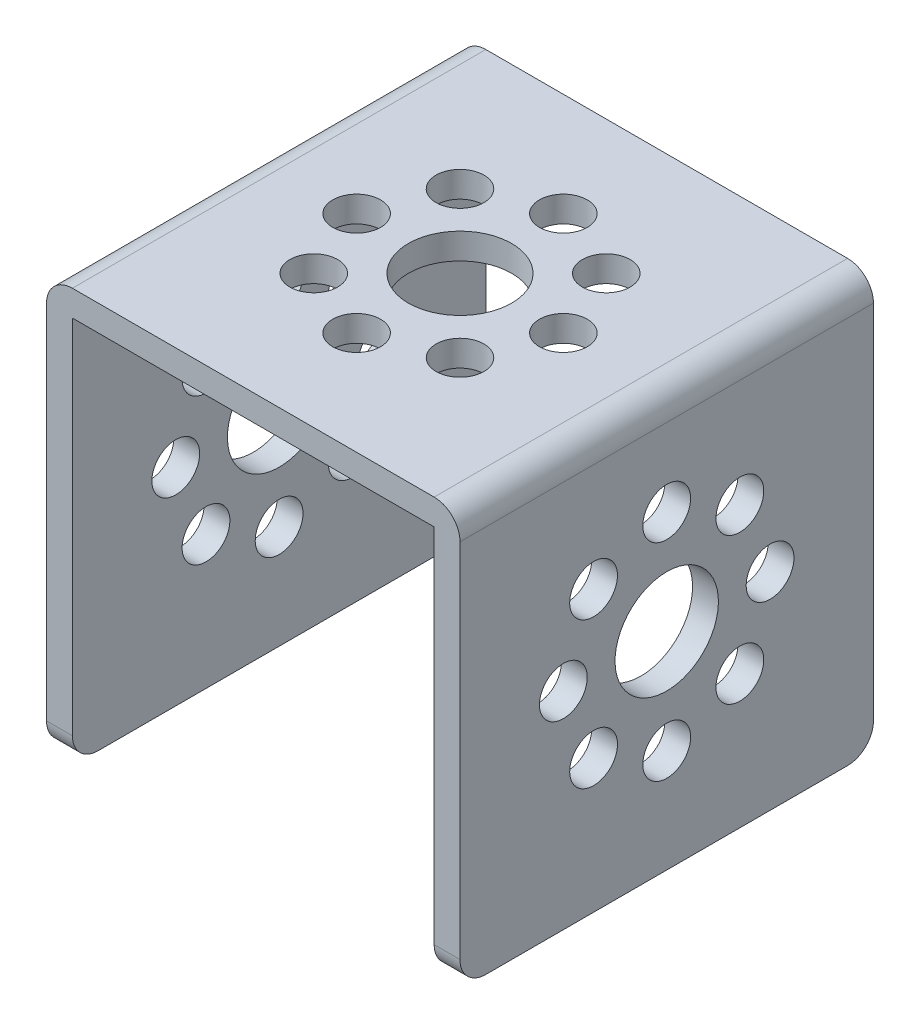
from build123d import *

# Parameters (mm, degrees)
BOSS_EXTRUDE1_DEPTH = 32
SKETCH2_R           = 1.85
SKETCH2_R_2         = 4
CUT_EXTRUDE1_DEPTH  = 49
SKETCH3_R           = 1.85
SKETCH3_R_2         = 4
CUT_EXTRUDE2_DEPTH  = 49
FILLET1_R           = 2


with BuildPart() as part:
    # Sketch1 → Boss-Extrude1 (new body)
    with BuildSketch(Plane.XY):
        Polygon((14, -16), (16, -16), (16, 16), (-16, 16), (-16, -16), (-14, -16), (-14, 14), (14, 14), align=None)
    extrude(amount=-BOSS_EXTRUDE1_DEPTH)

    # Sketch2 → Cut-Extrude1 (cut, through all)
    with BuildSketch(Plane(origin=(0, 16, 0), x_dir=(1, 0, 0), z_dir=(0, 1, 0))):
        with Locations((8, 16)):
            Circle(SKETCH2_R)
        with Locations((0, 8)):
            Circle(SKETCH2_R)
        with Locations((0, 16)):
            Circle(SKETCH2_R_2)
        with Locations((0, 24)):
            Circle(SKETCH2_R)
        with Locations((-5.66, 21.66)):
            Circle(SKETCH2_R)
        with Locations((-5.66, 10.34)):
            Circle(SKETCH2_R)
        with Locations((-8, 16)):
            Circle(SKETCH2_R)
        with Locations((5.66, 21.66)):
            Circle(SKETCH2_R)
        with Locations((5.66, 10.34)):
            Circle(SKETCH2_R)
    extrude(amount=-CUT_EXTRUDE1_DEPTH, mode=Mode.SUBTRACT)

    # Sketch3 → Cut-Extrude2 (cut, through all)
    with BuildSketch(Plane(origin=(16, 0, 0), x_dir=(0, 0, -1), z_dir=(1, 0, 0))):
        with Locations((24, 0)):
            Circle(SKETCH3_R)
        with Locations((16, -8)):
            Circle(SKETCH3_R)
        with Locations((16, 0)):
            Circle(SKETCH3_R_2)
        with Locations((16, 8)):
            Circle(SKETCH3_R)
        with Locations((10.34, 5.66)):
            Circle(SKETCH3_R)
        with Locations((10.34, -5.66)):
            Circle(SKETCH3_R)
        with Locations((8, 0)):
            Circle(SKETCH3_R)
        with Locations((21.66, 5.66)):
            Circle(SKETCH3_R)
        with Locations((21.66, -5.66)):
            Circle(SKETCH3_R)
    extrude(amount=-CUT_EXTRUDE2_DEPTH, mode=Mode.SUBTRACT)

    # Fillet1
    fillet1_edges = [part.edges().sort_by_distance(p)[0] for p in [
        (-15, -16, -32),
        (15, -16, -32),
        (-15, -16, 0),
        (15, -16, 0),
        (-16, 16, -16),
        (16, 16, -16),
    ]]
    fillet(fillet1_edges, radius=FILLET1_R)


solid = part.part
